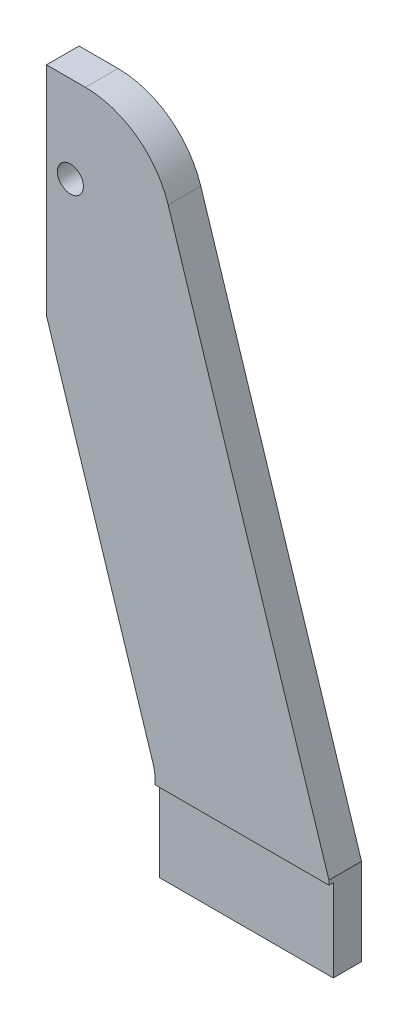
from build123d import *

# Parameters (mm, degrees)
SALIENTE_EXTRUIR1_DEPTH                        = 15
CROQUIS2_R                                     = 6
CORTAR_EXTRUIR1_DEPTH                          = 311.845620847
PERFORADOR_PARA_ROSCAR_PARA_MACHO_DE_ROS_D     = 3.3
PERFORADOR_PARA_ROSCAR_PARA_MACHO_DE_ROS_DEPTH = 7
PERFORADOR_PARA_ROSCAR_PARA_MACHO_DE_ROS_TIP   = 0.991420021
CROQUIS9_W                                     = 80
CROQUIS9_H                                     = 38
CORTAR_EXTRUIR2_DEPTH                          = 2
TALADROS_DE_ESPIGA_DE_4_0MM1_D                 = 4
TALADROS_DE_ESPIGA_DE_4_0MM1_DEPTH             = 17
TALADROS_DE_ESPIGA_DE_4_0MM1_TIP               = 1.201721238
TALADRO_ROSCADO_M41_D                          = 3.3
TALADRO_ROSCADO_M41_DEPTH                      = 11.5
TALADRO_ROSCADO_M41_TIP                        = 0.991420021


with BuildPart() as part:
    # Croquis1 → Saliente-Extruir1 (new body)
    with BuildSketch(Plane.XY):
        with BuildLine():
            Line((80, 0), (80, 40))
            Line((80, 40), (6.016406662, 272.145884266))
            ThreePointArc((6.016406662, 272.145884266), (-8.492384821, 292.294236101), (-32.094976092, 300))
            Line((-32.094976092, 300), (-50, 300))
            Line((-50, 300), (-50, 200))
            Line((-50, 200), (-0.944308623, 46.072942133))
            ThreePointArc((-0.944308623, 46.072942133), (-0.23748716, 43.0729605), (0, 40))
            Line((0, 40), (0, 0))
            Line((0, 0), (80, 0))
        make_face()
    extrude(amount=SALIENTE_EXTRUIR1_DEPTH)

    # Croquis2 → Cortar-Extruir1 (cut, through all)
    with BuildSketch(Plane(origin=(0, 0, 0), x_dir=(-1, 0, 0), z_dir=(0, 0, -1))):
        with Locations((39, 260)):
            Circle(CROQUIS2_R)
    extrude(amount=-CORTAR_EXTRUIR1_DEPTH, mode=Mode.SUBTRACT)

    # Perforador para roscar para macho de roscar para M44
    with Locations(Plane(origin=(0, 0, 0), x_dir=(-1, 0, 0), z_dir=(0, 0, -1))):
        with Locations((39, 241.75), (39, 278.25)):
            Hole(PERFORADOR_PARA_ROSCAR_PARA_MACHO_DE_ROS_D / 2, depth=PERFORADOR_PARA_ROSCAR_PARA_MACHO_DE_ROS_DEPTH)
            with Locations((0, 0, -(PERFORADOR_PARA_ROSCAR_PARA_MACHO_DE_ROS_DEPTH + PERFORADOR_PARA_ROSCAR_PARA_MACHO_DE_ROS_TIP / 2))):  # 118° drill point
                Cone(0, PERFORADOR_PARA_ROSCAR_PARA_MACHO_DE_ROS_D / 2, PERFORADOR_PARA_ROSCAR_PARA_MACHO_DE_ROS_TIP, mode=Mode.SUBTRACT)

    # Croquis9 → Cortar-Extruir2 (cut)
    with BuildSketch(Plane.XY.offset(15)):
        with Locations((40, 19)):
            Rectangle(CROQUIS9_W, CROQUIS9_H)
    extrude(amount=-CORTAR_EXTRUIR2_DEPTH, mode=Mode.SUBTRACT)

    # Taladros de espiga de Ø4.0mm1
    with Locations(Plane.ZY.offset(50)):
        with Locations((6, 274), (6, 246)):
            Hole(TALADROS_DE_ESPIGA_DE_4_0MM1_D / 2, depth=TALADROS_DE_ESPIGA_DE_4_0MM1_DEPTH)
            with Locations((0, 0, -(TALADROS_DE_ESPIGA_DE_4_0MM1_DEPTH + TALADROS_DE_ESPIGA_DE_4_0MM1_TIP / 2))):  # 118° drill point
                Cone(0, TALADROS_DE_ESPIGA_DE_4_0MM1_D / 2, TALADROS_DE_ESPIGA_DE_4_0MM1_TIP, mode=Mode.SUBTRACT)

    # Taladro roscado M41
    with Locations(Plane.ZY.offset(50)):
        with Locations((6, 285), (6, 235)):
            Hole(TALADRO_ROSCADO_M41_D / 2, depth=TALADRO_ROSCADO_M41_DEPTH)
            with Locations((0, 0, -(TALADRO_ROSCADO_M41_DEPTH + TALADRO_ROSCADO_M41_TIP / 2))):  # 118° drill point
                Cone(0, TALADRO_ROSCADO_M41_D / 2, TALADRO_ROSCADO_M41_TIP, mode=Mode.SUBTRACT)


solid = part.part
